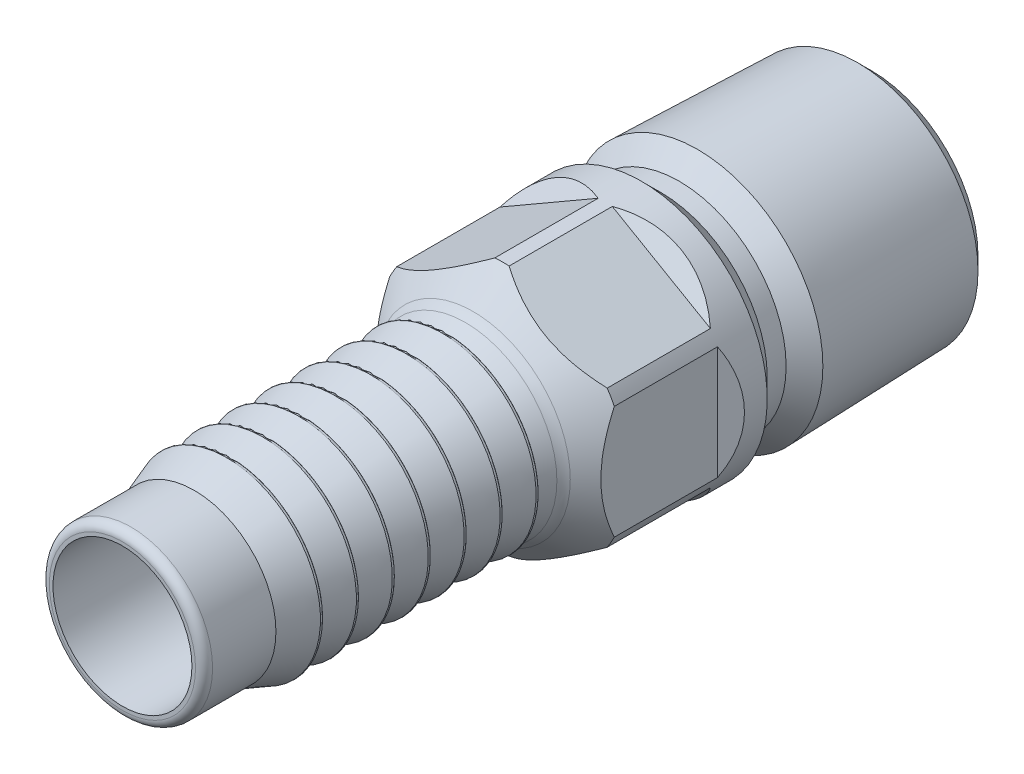
from build123d import *

# Parameters (mm, degrees)
LPATTERN1_COUNT    = 7
LPATTERN1_PITCH    = 3.81
FILLET1_R          = 0.254
FILLET2_R          = 3.175
SKETCH7_OUTSIDE_W  = 211.416
SKETCH7_OUTSIDE_H  = 211.416
SKETCH7_OUTSIDE_R  = 11.332659983
CUT_EXTRUDE1_DEPTH = 82.584527309
CUT_EXTRUDE1_DRAFT = -45
SKETCH9_OUTSIDE_W  = 46.246
SKETCH9_OUTSIDE_H  = 46.246
CUT_EXTRUDE2_DEPTH = 18.735026
CHAMFER1_SIZE      = 1.841903285


# Read off the part's stored shape, not the designer's step: Cut-Revolve2
with BuildPart() as part:
    # Sketch2 → Revolve1 (revolve)
    with BuildSketch(Plane(origin=(0, 0, 0), x_dir=(0, 0, -1), z_dir=(1, 0, 0)), mode=Mode.PRIVATE) as revolve1_sk:
        Polygon((-39.6875, 7.366), (-39.6875, 9.921875), (-2.8575, 9.921875), (0.555625, 13.335), (39.6875, 13.335), (39.6875, 10.4648), (19.5326, 10.4648), (16.4338, 7.366), align=None)
    revolve(revolve1_sk.sketch.rotate(Axis((0, 0, 39.6875), (0, 0, -1)), 90), axis=Axis((0, 0, 39.6875), (0, 0, -1)))

    # Sketch3 → Cut-Revolve1 (revolve, cut)
    with BuildSketch(Plane(origin=(0, 0, 0), x_dir=(0, 0, -1), z_dir=(1, 0, 0)), mode=Mode.PRIVATE) as cut_revolve1_sk:
        with BuildLine():
            Line((-39.6875, 9.921875), (-39.6875, 7.747))
            ThreePointArc((-39.6875, 7.747), (-39.422468249, 8.386843249), (-38.782625, 8.651875))
            Line((-38.782625, 8.651875), (-5.3975, 8.651875))
            Line((-5.3975, 8.651875), (-2.8575, 9.921875))
            Line((-2.8575, 9.921875), (-39.6875, 9.921875))
        make_face()
        Polygon((19.5326, 13.335), (39.6875, 13.335), (39.6875, 12.707475311), align=None)
    revolve(cut_revolve1_sk.sketch.rotate(Axis((0, 0, 39.6875), (0, 0, -1)), 90), axis=Axis((0, 0, 39.6875), (0, 0, -1)), mode=Mode.SUBTRACT)

    # Sketch4 → Revolve2 (revolve)
    with BuildSketch(Plane(origin=(0, 0, 0), x_dir=(0, 0, -1), z_dir=(1, 0, 0)), mode=Mode.PRIVATE) as revolve2_sk:
        with BuildLine():
            Line((-5.3975, 8.651875), (-5.3975, 9.667875))
            ThreePointArc((-5.3975, 9.667875), (-5.505600287, 9.875791507), (-5.737887983, 9.906732942))
            Line((-5.737887983, 9.906732942), (-9.2075, 8.651875))
            Line((-9.2075, 8.651875), (-5.3975, 8.651875))
        make_face()
    revolve2 = revolve(revolve2_sk.sketch.rotate(Axis((0, 0, 5.3975), (0, 0, 1)), 90), axis=Axis((0, 0, 5.3975), (0, 0, 1)))

    # LPattern1: Revolve2 ×7
    with Locations(*[(0, 0, i * LPATTERN1_PITCH) for i in range(1, LPATTERN1_COUNT)]):
        add(revolve2)

    # Fillet1
    fillet1_edges = [part.edges().sort_by_distance(p)[0] for p in [
        (-8.651875, 0, 5.3975),
    ]]
    fillet(fillet1_edges, radius=FILLET1_R)

    # Fillet2
    fillet2_edges = [part.edges().sort_by_distance(p)[0] for p in [
        (-9.921875, 0, 2.8575),
        (-7.366, 0, -16.4338),
        (-10.4648, 0, -19.5326),
    ]]
    fillet(fillet2_edges, radius=FILLET2_R)


with BuildPart() as cut_extrude1_tool:
    # Sketch7 outside → Cut-Extrude1 (with draft: the straight prism first)
    with BuildSketch(Plane(origin=(0, 0, -39.6875), x_dir=(-1, 0, 0), z_dir=(0, 0, -1))):
        Rectangle(SKETCH7_OUTSIDE_W, SKETCH7_OUTSIDE_H)
        Circle(SKETCH7_OUTSIDE_R, mode=Mode.SUBTRACT)
    extrude(amount=-CUT_EXTRUDE1_DEPTH)
    # Cut-Extrude1: the draft: its side faces are tilted about the plane it starts from
    cut_extrude1_sides = [cut_extrude1_tool.faces().sort_by_distance(p)[0] for p in [
        (0, -105.708, 1.604763654),
        (-105.708, 0, 1.604763654),
        (0, 105.708, 1.604763654),
        (105.708, 0, 1.604763654),
        (11.332659983, 0, 1.604763654),
    ]]
    draft(cut_extrude1_sides, Plane(origin=(0, 0, -39.6875), x_dir=(-1, 0, 0), z_dir=(0, 0, -1)), CUT_EXTRUDE1_DRAFT)


with BuildPart() as part_1:
    add(part.part)

    # Cut-Extrude1: cut by cut_extrude1_tool
    add(cut_extrude1_tool.part, mode=Mode.SUBTRACT)

    # Cut-Revolve2 outline → Cut-Revolve2 (revolve, cut)
    with BuildSketch(Plane.XZ):
        Polygon((11.332659983, -17.34220568), (11.332659983, -19.344545697), (13.280217697, -21.292103412), (13.335, -21.292103412), (13.335, -15.339865662), align=None)
    revolve(axis=Axis((0, 0, 0), (0, 0, 1)), mode=Mode.SUBTRACT)

    # Sketch9 outside → Cut-Extrude2 (cut)
    with BuildSketch(Plane.XY.offset(5.3975)):
        Rectangle(SKETCH9_OUTSIDE_W, SKETCH9_OUTSIDE_H)
        Polygon((0, 13.748153285), (-11.90625, 6.874076643), (-11.90625, -6.874076643), (0, -13.748153285), (11.90625, -6.874076643), (11.90625, 6.874076643), align=None, mode=Mode.SUBTRACT)
    extrude(amount=-CUT_EXTRUDE2_DEPTH, mode=Mode.SUBTRACT)

    # Chamfer1
    # the kernel refuses this chamfer: 1.841903285 mm, written as the material it adds along each edge
    with BuildSketch(Plane(origin=(15.256035138, 4.940077291, -13.337526), x_dir=(-0.01374793830529338, -0.02381212764409052, 0.9996219169112968), z_dir=(-0.8660254037844388, 0.4999999999999997, 0))) as chamfer1_piece_1_section:
        Polygon((CHAMFER1_SIZE * 0.999621916954, CHAMFER1_SIZE * 0.0274958766118), (-CHAMFER1_SIZE * 0.0274958766118, CHAMFER1_SIZE * 0.999621916954), (0, 0), align=None)
    chamfer1_piece_1 = extrude(amount=21.48415069, mode=Mode.PRIVATE)
    chamfer1_piece_1 = chamfer1_piece_1 & Plane(origin=(0, 0, -12.639000405), x_dir=(1, 0, 0), z_dir=(0, 0, -1)) * Cylinder(13.335, 51, mode=Mode.PRIVATE)
    add(chamfer1_piece_1)
    with BuildSketch(Plane(origin=(-15.256035138, -4.940077291, -13.337526), x_dir=(0.013747938305293347, 0.023812127644090464, 0.9996219169112968), z_dir=(0.8660254037844388, -0.49999999999999967, 0))) as chamfer1_piece_2_section:
        Polygon((CHAMFER1_SIZE * 0.999621916954, CHAMFER1_SIZE * 0.0274958766118), (-CHAMFER1_SIZE * 0.0274958766118, CHAMFER1_SIZE * 0.999621916954), (0, 0), align=None)
    chamfer1_piece_2 = extrude(amount=21.48415069, mode=Mode.PRIVATE)
    chamfer1_piece_2 = chamfer1_piece_2 & Plane(origin=(0, 0, -12.639000405), x_dir=(1, 0, 0), z_dir=(0, 0, -1)) * Cylinder(13.335, 51, mode=Mode.PRIVATE)
    add(chamfer1_piece_2)
    with BuildSketch(Plane(origin=(-11.90625, 10.742075345, -13.337526), x_dir=(0.027495876610586077, 0, 0.9996219169112968), z_dir=(0, -1, 0))) as chamfer1_piece_3_section:
        Polygon((CHAMFER1_SIZE * 0.999621916954, CHAMFER1_SIZE * 0.0274958766117), (-CHAMFER1_SIZE * 0.0274958766117, CHAMFER1_SIZE * 0.999621916954), (0, 0), align=None)
    chamfer1_piece_3 = extrude(amount=21.48415069, mode=Mode.PRIVATE)
    chamfer1_piece_3 = chamfer1_piece_3 & Plane(origin=(0, 0, -12.639000417), x_dir=(1, 0, 0), z_dir=(0, 0, -1)) * Cylinder(13.335, 51, mode=Mode.PRIVATE)
    add(chamfer1_piece_3)
    with BuildSketch(Plane(origin=(3.349785138, 15.682152636, -13.337526), x_dir=(0.013747938305293033, -0.023812127644089905, 0.9996219169112968), z_dir=(-0.8660254037844387, -0.49999999999999994, 0))) as chamfer1_piece_4_section:
        Polygon((CHAMFER1_SIZE * 0.999621916954, CHAMFER1_SIZE * 0.0274958766118), (-CHAMFER1_SIZE * 0.0274958766117, CHAMFER1_SIZE * 0.999621916954), (0, 0), align=None)
    chamfer1_piece_4 = extrude(amount=21.48415069, mode=Mode.PRIVATE)
    chamfer1_piece_4 = chamfer1_piece_4 & Plane(origin=(0, 0, -12.639000405), x_dir=(1, 0, 0), z_dir=(0, 0, -1)) * Cylinder(13.335, 51, mode=Mode.PRIVATE)
    add(chamfer1_piece_4)
    with BuildSketch(Plane(origin=(-3.349785138, -15.682152636, -13.337526), x_dir=(-0.01374793830529321, 0.02381212764409021, 0.9996219169112968), z_dir=(0.8660254037844387, 0.49999999999999994, 0))) as chamfer1_piece_5_section:
        Polygon((CHAMFER1_SIZE * 0.999621916954, CHAMFER1_SIZE * 0.0274958766118), (-CHAMFER1_SIZE * 0.0274958766118, CHAMFER1_SIZE * 0.999621916954), (0, 0), align=None)
    chamfer1_piece_5 = extrude(amount=21.48415069, mode=Mode.PRIVATE)
    chamfer1_piece_5 = chamfer1_piece_5 & Plane(origin=(0, 0, -12.639000405), x_dir=(1, 0, 0), z_dir=(0, 0, -1)) * Cylinder(13.335, 51, mode=Mode.PRIVATE)
    add(chamfer1_piece_5)
    with BuildSketch(Plane(origin=(11.90625, -10.742075345, -13.337526), x_dir=(-0.027495876610586077, 0, 0.9996219169112968), z_dir=(0, 1, 0))) as chamfer1_piece_6_section:
        Polygon((CHAMFER1_SIZE * 0.999621916954, CHAMFER1_SIZE * 0.0274958766117), (-CHAMFER1_SIZE * 0.0274958766117, CHAMFER1_SIZE * 0.999621916954), (0, 0), align=None)
    chamfer1_piece_6 = extrude(amount=21.48415069, mode=Mode.PRIVATE)
    chamfer1_piece_6 = chamfer1_piece_6 & Plane(origin=(0, 0, -12.639000405), x_dir=(1, 0, 0), z_dir=(0, 0, -1)) * Cylinder(13.335, 51, mode=Mode.PRIVATE)
    add(chamfer1_piece_6)


solid = part_1.part
